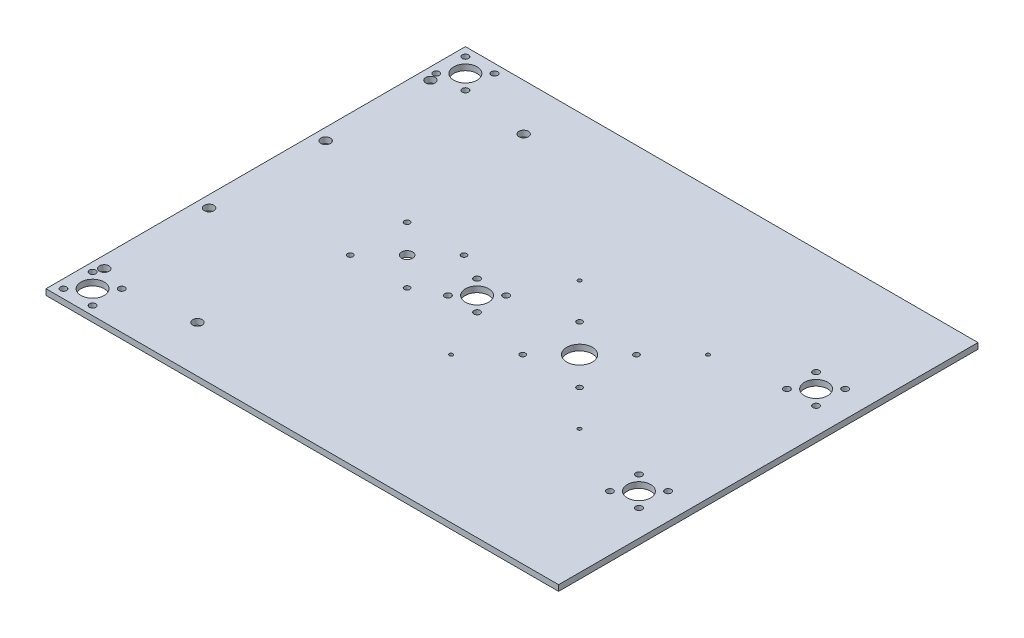
from build123d import *

# Parameters (mm, degrees)
SKETCH1_W               = 279.4
SKETCH1_H               = 228.6
BOSS_EXTRUDE1_DEPTH     = 3.175
SKETCH3_R               = 2.600000007
CUT_EXTRUDE1_DEPTH      = 181.528835993
SKETCH5_R               = 1.5
SKETCH5_R_2             = 3.007999953
CUT_EXTRUDE2_DEPTH      = 181.528835993
SKETCH7_R               = 0.999998
CUT_EXTRUDE3_DEPTH      = 181.528835993
CUT_EXTRUDE5_DEPTH      = 181.528835993
CUT_EXTRUDE5_DEPTH_BACK = 181.528835993
SKETCH9_R               = 1.726999975
SKETCH9_R_2             = 6.35
CUT_EXTRUDE6_DEPTH      = 181.528835993
CUT_EXTRUDE6_DEPTH_BACK = 181.528835993
SKETCH11_R              = 1.5
SKETCH11_R_2            = 6.985


with BuildPart() as part:
    # Sketch1 → Boss-Extrude1 (new body)
    with BuildSketch(Plane(origin=(0, 0, 0), x_dir=(1, 0, 0), z_dir=(0, 1, 0))):
        Rectangle(SKETCH1_W, SKETCH1_H)
    extrude(amount=BOSS_EXTRUDE1_DEPTH)

    # Sketch3 → Cut-Extrude1 (cut, through all)
    with BuildSketch(Plane(origin=(0, 3.175, 0), x_dir=(1, 0, 0), z_dir=(0, 1, 0))):
        with Locations((-133.35, -31.75)):
            Circle(SKETCH3_R)
        with Locations((-82.55, -88.9)):
            Circle(SKETCH3_R)
        with Locations((-133.35, -88.9)):
            Circle(SKETCH3_R)
    cut_extrude1 = extrude(amount=-CUT_EXTRUDE1_DEPTH, mode=Mode.SUBTRACT)

    # Mirror1: Cut-Extrude1 across plane
    add(cut_extrude1.mirror(Plane.XY), mode=Mode.SUBTRACT)

    # Sketch5 → Cut-Extrude2 (cut, through all)
    with BuildSketch(Plane(origin=(0, 3.175, 0), x_dir=(1, 0, 0), z_dir=(0, 1, 0))):
        with Locations((-41.674, 15.5)):
            Circle(SKETCH5_R)
        with Locations((-41.674, -15.5)):
            Circle(SKETCH5_R)
        with Locations((-72.674, 15.5)):
            Circle(SKETCH5_R)
        with Locations((-72.674, -15.5)):
            Circle(SKETCH5_R)
        with Locations((-57.174, 0)):
            Circle(SKETCH5_R_2)
    extrude(amount=-CUT_EXTRUDE2_DEPTH, mode=Mode.SUBTRACT)

    # Sketch7 → Cut-Extrude3 (cut, through all)
    with BuildSketch(Plane(origin=(0, 3.175, 0), x_dir=(1, 0, 0), z_dir=(0, 1, 0))):
        with Locations((71.831780291, -35.001796999)):
            Circle(SKETCH7_R)
        with Locations((1.828205277, -35.001796999)):
            Circle(SKETCH7_R)
        with Locations((1.828205277, 35.001778016)):
            Circle(SKETCH7_R)
        with Locations((71.831780291, 35.001778016)):
            Circle(SKETCH7_R)
    extrude(amount=-CUT_EXTRUDE3_DEPTH, mode=Mode.SUBTRACT)

    # Sketch9 → Cut-Extrude5 (cut, two sides: drawn at the far end of the back side and taken through both)
    with BuildSketch(Plane(origin=(0, 3.175, 0), x_dir=(1, 0, 0), z_dir=(0, 1, 0)).offset(-CUT_EXTRUDE5_DEPTH_BACK)):
        with Locations((-119.0625, -109.5375)):
            Circle(SKETCH9_R)
        with Locations((-119.0625, -93.6625)):
            Circle(SKETCH9_R)
        with Locations((-134.9375, -93.6625)):
            Circle(SKETCH9_R)
        with Locations((-134.9375, -109.5375)):
            Circle(SKETCH9_R)
        with Locations((-127, -101.6)):
            Circle(SKETCH9_R_2)
        with Locations((125.4125, -56.1975)):
            Circle(SKETCH9_R)
        with Locations((125.4125, -40.3225)):
            Circle(SKETCH9_R)
        with Locations((117.475, -48.26)):
            Circle(SKETCH9_R_2)
        with Locations((109.5375, -40.3225)):
            Circle(SKETCH9_R)
        with Locations((109.5375, -56.1975)):
            Circle(SKETCH9_R)
        with Locations((-11.1125, 7.9375)):
            Circle(SKETCH9_R)
        with Locations((-11.1125, -7.9375)):
            Circle(SKETCH9_R)
        with Locations((-19.05, 0)):
            Circle(SKETCH9_R_2)
        with Locations((-26.9875, -7.9375)):
            Circle(SKETCH9_R)
        with Locations((-26.9875, 7.9375)):
            Circle(SKETCH9_R)
        with Locations((109.5375, 56.1975)):
            Circle(SKETCH9_R)
        with Locations((109.5375, 40.3225)):
            Circle(SKETCH9_R)
        with Locations((125.4125, 56.1975)):
            Circle(SKETCH9_R)
        with Locations((117.475, 48.26)):
            Circle(SKETCH9_R_2)
        with Locations((125.4125, 40.3225)):
            Circle(SKETCH9_R)
        with Locations((-119.0625, 93.6625)):
            Circle(SKETCH9_R)
        with Locations((-119.0625, 109.5375)):
            Circle(SKETCH9_R)
        with Locations((-134.9375, 109.5375)):
            Circle(SKETCH9_R)
        with Locations((-134.9375, 93.6625)):
            Circle(SKETCH9_R)
        with Locations((-127, 101.6)):
            Circle(SKETCH9_R_2)
    extrude(amount=CUT_EXTRUDE5_DEPTH + CUT_EXTRUDE5_DEPTH_BACK, mode=Mode.SUBTRACT)

    # Sketch11 → Cut-Extrude6 (cut, two sides: drawn at the far end of the back side and taken through both)
    with BuildSketch(Plane(origin=(0, 3.175, 0), x_dir=(1, 0, 0), z_dir=(0, 1, 0)).offset(-CUT_EXTRUDE6_DEPTH_BACK)):
        with Locations((52.33, 15.5)):
            Circle(SKETCH11_R)
        with Locations((52.33, -15.5)):
            Circle(SKETCH11_R)
        with Locations((21.33, -15.5)):
            Circle(SKETCH11_R)
        with Locations((21.33, 15.5)):
            Circle(SKETCH11_R)
        with Locations((36.83, 0)):
            Circle(SKETCH11_R_2)
    extrude(amount=CUT_EXTRUDE6_DEPTH + CUT_EXTRUDE6_DEPTH_BACK, mode=Mode.SUBTRACT)


solid = part.part
